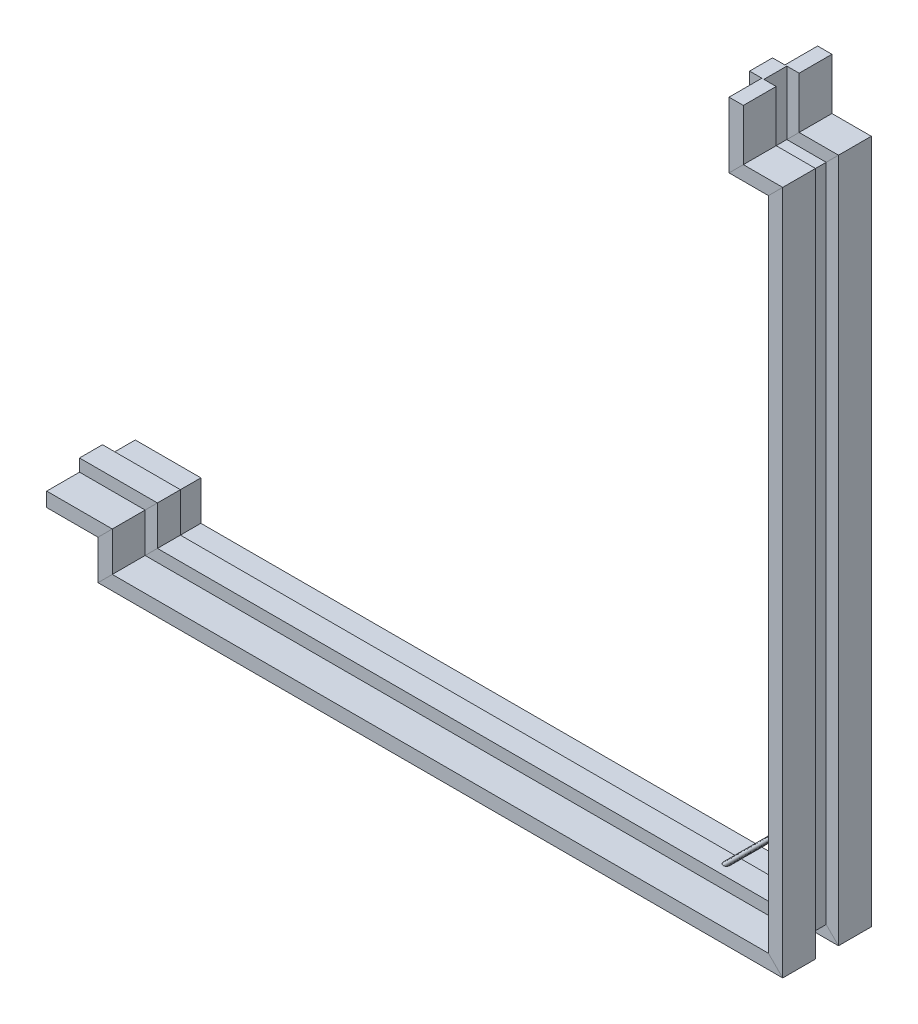
from build123d import *

# Parameters (mm, degrees)
SWEEP1_START   = -13.5
SWEEP1_DEPTH   = 10
SWEEP1_START_2 = 3.5
SWEEP1_2_DEPTH = 10
SWEEP1_START_3 = -3.5
SWEEP1_3_DEPTH = 7
SKETCH12_R     = 1


# Read off the part's stored shape, not the designer's step: Sweep1
with BuildPart() as part:
    # Sweep1 outline → Sweep1 (new body)
    with BuildSketch(Plane.XY.offset(SWEEP1_START)):
        Polygon((-7.642649587, 204.357350413), (-7.642649587, 220), (-12, 220), (-12, 200), (0, 200), (0, 0), (-200, 0), (-200, 12), (-220, 12), (-220, 7.642649587), (-204.357350413, 7.642649587), (-204.357350413, -4.357350413), (4.357350413, -4.357350413), (4.357350413, 204.357350413), align=None)
    extrude(amount=SWEEP1_DEPTH)



with BuildPart() as body_2:
    # Sweep1 2 outline → Sweep1 2 (new body)
    with BuildSketch(Plane.XY.offset(SWEEP1_START_2)):
        Polygon((-7.642649587, 204.357350413), (-7.642649587, 220), (-12, 220), (-12, 200), (0, 200), (0, 0), (-200, 0), (-200, 12), (-220, 12), (-220, 7.642649587), (-204.357350413, 7.642649587), (-204.357350413, -4.357350413), (4.357350413, -4.357350413), (4.357350413, 204.357350413), align=None)
    extrude(amount=SWEEP1_2_DEPTH)


with BuildPart() as part_1:
    add(part.part)

    add(body_2.part)  # Sweep1 3 merges body 2
    # Sweep1 3 outline → Sweep1 3 (add)
    with BuildSketch(Plane.XY.offset(SWEEP1_START_3)):
        Polygon((-11.392649587, 200.607350413), (-11.392649587, 220), (-15.74831078, 220), (-15.74831078, 196.25168922), (-3.74831078, 196.25168922), (-3.74831078, 3.74831078), (-196.25168922, 3.74831078), (-196.25168922, 15.74831078), (-220, 15.74831078), (-220, 11.392649587), (-200.607350413, 11.392649587), (-200.607350413, -0.607350413), (0.607350413, -0.607350413), (0.607350413, 200.607350413), align=None)
    extrude(amount=SWEEP1_3_DEPTH)

    # Sweep2: sweep along a path in Sketch11
    with BuildLine(Plane.XY) as sweep2_path:
        Line((-30, 0), (0, 30))
    # Sketch12 → Sweep2 (sweep)
    with BuildSketch(Plane(origin=(0, 0, 0), x_dir=(0, 0, -1), z_dir=(1, 0, 0))):
        with Locations((0, 30)):
            Circle(SKETCH12_R)
    sweep(path=sweep2_path.line)


solid = part_1.part
